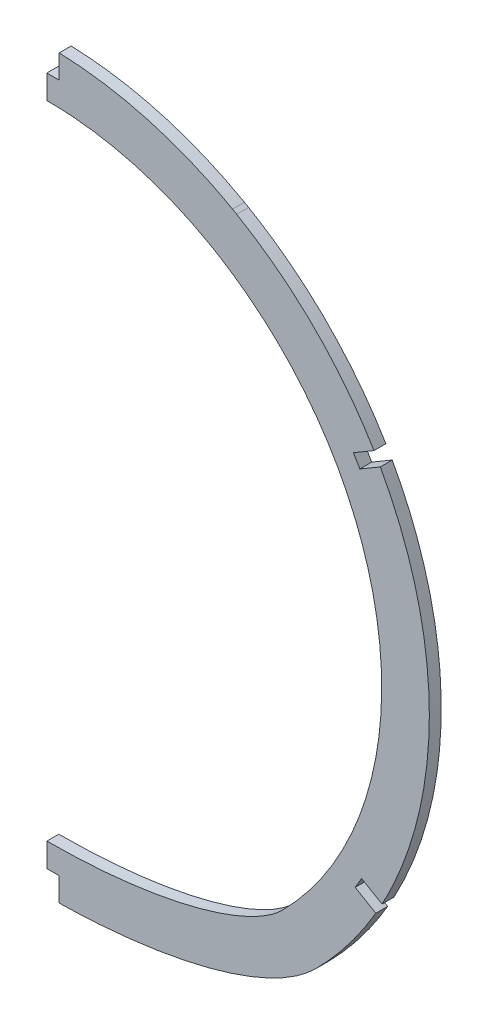
from build123d import *

# Parameters (mm, degrees)
BOSS_EXTRUDE1_DEPTH = 3.175
SKETCH3_W           = 129.389558459
SKETCH3_H           = 294.720660933
CUT_EXTRUDE1_DEPTH  = 146.946732918
SKETCH4_W           = 3.302
SKETCH4_H           = 12.7
CUT_EXTRUDE2_DEPTH  = 146.946411659


with BuildPart() as part:
    # Sketch2 → Boss-Extrude1 (new body)
    with BuildSketch(Plane.XY):
        with BuildLine():
            add(Edge.make_bspline(
                [(-71.677392112, -72.91043434), (-72.109242456, -72.4766599), (-72.972872043, -71.593614958), (-74.469591152, -70.002616718), (-75.837182996, -68.488043391), (-77.186084408, -66.931897067), (-78.515677479, -65.334729876), (-79.824432739, -63.69624614), (-81.54760822, -61.446428575), (-83.64161213, -58.529673548), (-85.629566809, -55.501403393), (-87.162218254, -52.997335562), (-88.285911427, -51.070131488), (-90.114728738, -47.772436811), (-92.549922179, -42.891387424), (-95.3516338, -36.175158441), (-97.806777615, -28.854790192), (-99.416568113, -22.492651102), (-100.484378106, -16.973479224), (-101.217383692, -12.115821661), (-101.805900705, -6.108471449), (-102.055561509, 1.055644647), (-101.63758347, 11.916616183), (-99.581715265, 24.703392789), (-94.947787628, 39.477591596), (-88.656512854, 52.708120751), (-80.043367163, 65.554146484), (-69.871244821, 76.755385293), (-58.636991603, 85.914826096), (-47.202028885, 92.898966836), (-35.790499648, 98.052224226), (-24.000842482, 101.716725174), (-12.029496563, 103.894248368), (-3.656941748, 104.395312689), (0.99110515, 104.372307848), (2.644688984, 104.347784008), (5.295920706, 104.255895368), (8.944129249, 104.002381094), (12.923536456, 103.566176285), (16.897932891, 102.969160213), (20.860675893, 102.210568115), (24.80503533, 101.28991654), (28.724197829, 100.207008268), (32.611281662, 98.961940132), (36.459348765, 97.555109249), (39.942943882, 96.118550993), (42.44327487, 94.981609399), (43.99462248, 94.237634049), (44.922549304, 93.78091779), (45.846607961, 93.314294304), (46.766722746, 92.837849145), (47.682656642, 92.351383169), (48.561810847, 91.873519084), (49.188310006, 91.524412896), (49.500915025, 91.348034768)],
                knots=[0, 0, 0, 0, 0.006795371, 0.013653749, 0.020575359, 0.027560428, 0.034609183, 0.041721853, 0.048898669, 0.063445664, 0.078252032, 0.085753069, 0.093319659, 0.100952039, 0.124124286, 0.148784986, 0.174947707, 0.20262677, 0.215493637, 0.232144402, 0.252599943, 0.276885796, 0.305032091, 0.363115877, 0.408011314, 0.462235121, 0.511576331, 0.564908162, 0.615597651, 0.658548959, 0.700915758, 0.742691235, 0.783870362, 0.824449909, 0.827808956, 0.831171349, 0.841278604, 0.854801757, 0.868378359, 0.882008332, 0.895691582, 0.909427999, 0.923217451, 0.937059793, 0.95095486, 0.964902468, 0.975397534, 0.978902417, 0.982410558, 0.985921952, 0.989436598, 0.99295449, 0.996475625, 1, 1, 1, 1], degree=3))
            add(Edge.make_bspline(
                [(49.500915025, 91.348034768), (49.872005924, 91.138482333), (50.241810712, 90.926750039), (50.610303013, 90.712853821)],
                knots=[0, 0, 0, 0, 1, 1, 1, 1], degree=3))
            add(Edge.make_bspline(
                [(50.610303013, 90.712853821), (51.128442093, 90.411846037), (52.167202685, 89.796039228), (53.932536969, 88.703576387), (55.579762788, 87.638711627), (57.218137155, 86.533145805), (58.847026669, 85.387425363), (60.465187486, 84.201108463), (62.61485058, 82.559008476), (65.268683437, 80.403244909), (68.38020159, 77.661045558), (71.420405526, 74.753669295), (74.379227375, 71.68115848), (77.246352549, 68.444125522), (79.542797672, 65.619898893), (81.324264236, 63.280297585), (82.635173495, 61.479754257), (83.915139631, 59.639466174), (85.682600666, 56.976700672), (87.896856718, 53.369477174), (90.462597049, 48.676901727), (92.889220315, 43.626105667), (95.132677705, 38.215723181), (97.146538959, 32.44823322), (98.88212407, 26.330630408), (100.289240179, 19.875099059), (101.25863273, 13.473856941), (101.817336128, 7.24671143), (102.015185645, 1.305015561), (101.87858065, -4.624237286), (101.39263307, -10.734726225), (100.537146292, -16.867570025), (99.329398352, -22.86381348), (97.893600846, -28.372193875), (96.656960211, -32.269847721), (95.785564151, -34.744415114), (95.0459628, -36.764317914), (93.953188789, -39.535816997), (92.43580554, -43.007047711), (90.821696456, -46.36490671), (89.118620831, -49.608230444), (87.334164726, -52.736260206), (85.475724639, -55.748623833), (83.55049497, -58.64531039), (81.56545684, -61.42664709), (79.307705413, -64.380683017), (77.436977348, -66.647222523), (76.007346494, -68.288860963), (75.29509586, -69.089727056), (74.579038656, -69.87823774), (73.859443089, -70.654502436), (73.136338858, -71.418398838), (72.317504882, -72.264736672), (71.891235125, -72.69667798), (71.678426975, -72.91043429)],
                knots=[0, 0, 0, 0, 0.010157109, 0.020393378, 0.030708694, 0.04110294, 0.051575992, 0.062127721, 0.072757993, 0.094253595, 0.116061609, 0.138180754, 0.160609666, 0.183346893, 0.206390897, 0.218027437, 0.229740057, 0.241528542, 0.253392669, 0.280162256, 0.30828042, 0.337739229, 0.368530108, 0.400643849, 0.434070605, 0.468799897, 0.504820602, 0.536144777, 0.567394405, 0.598569553, 0.629670285, 0.664058743, 0.696204476, 0.726123241, 0.753829745, 0.760691378, 0.767515904, 0.787767528, 0.807687634, 0.827278023, 0.846540474, 0.865476741, 0.88408856, 0.902377642, 0.920345676, 0.937994331, 0.961031903, 0.966703489, 0.972340071, 0.97794171, 0.983508463, 0.989040391, 0.99453755, 1, 1, 1, 1], degree=3))
            add(Edge.make_bspline(
                [(71.678426975, -72.91043429), (46.359928794, -98.341734638), (-46.358893881, -98.341734638), (-71.677392112, -72.91043434)],
                knots=[0, 0, 0, 0, 1, 1, 1, 1], degree=3, weights=[1, 1, 1, 1]))
        make_face()
        with BuildLine():
            add(Edge.make_bspline(
                [(-62.677197057, -63.950161522), (-62.895509204, -63.730876692), (-63.321725733, -63.298342375), (-64.002059554, -62.592101669), (-64.753829554, -61.794622516), (-65.703931611, -60.764569773), (-66.804574903, -59.527416198), (-68.556788175, -57.468052236), (-70.648178443, -54.835505477), (-73.811350461, -50.469012961), (-77.394544541, -44.756057433), (-82.302878117, -35.13540616), (-86.810757895, -22.360038108), (-90.354277409, -0.967371821), (-87.649941962, 26.350088977), (-73.333390238, 55.972118358), (-49.623996274, 78.708841275), (-24.487235723, 89.383519301), (-3.090994932, 92.115890306), (13.038963103, 91.197514401), (26.120286031, 87.996586306), (34.879374941, 84.524845656), (39.102105625, 82.510352052), (41.214271269, 81.410816796), (42.347028641, 80.797644792), (42.959233617, 80.456937494), (43.258169219, 80.288282027)],
                knots=[0, 0, 0, 0, 0.003906217, 0.007812434, 0.01171865, 0.015624867, 0.023437301, 0.031249734, 0.046874602, 0.062499469, 0.093749203, 0.124998938, 0.187498407, 0.249997875, 0.374996813, 0.499995751, 0.624994688, 0.749993626, 0.812493095, 0.874992564, 0.937492033, 0.968741767, 0.984366634, 0.992179068, 0.996085285, 0.999991501, 0.999991501, 0.999991501, 0.999991501], degree=3))
            add(Edge.make_bspline(
                [(43.258169219, 80.288282027), (43.339663738, 80.24226006), (43.502520945, 80.149972739), (43.746371392, 80.01083423), (43.989796594, 79.870982545), (44.151786326, 79.777278604), (44.232713854, 79.73030574)],
                knots=[0.002022438, 0.002022438, 0.002022438, 0.002022438, 0.251013535, 0.500004632, 0.748995729, 0.997986827, 0.997986827, 0.997986827, 0.997986827], degree=3))
            add(Edge.make_bspline(
                [(44.232713854, 79.73030574), (44.58444416, 79.525959484), (45.259622085, 79.127643656), (46.415361761, 78.422292298), (47.573803007, 77.692810893), (49.007921659, 76.758403592), (50.804832808, 75.530634538), (53.607223777, 73.493209173), (57.003409969, 70.790302329), (64.764138566, 63.842060668), (74.853642347, 51.769295456), (84.311822541, 33.000711524), (89.302574517, 12.581832114), (89.594071681, -8.463887057), (85.167338267, -29.022546245), (78.471156755, -43.288686452), (72.737789819, -52.004533398), (70.145497848, -55.492337454), (67.954788222, -58.18874646), (66.537169113, -59.834423786), (65.376799992, -61.124092609), (64.636118066, -61.923784826), (64.04885936, -62.544039678), (63.540759488, -63.072130947), (63.065749199, -63.559376825), (62.8132246, -63.814567336), (62.678231924, -63.950161468)],
                knots=[1.4601e-05, 1.4601e-05, 1.4601e-05, 1.4601e-05, 0.007826987, 0.015639373, 0.023451759, 0.031264145, 0.046888916, 0.062513688, 0.093763232, 0.125012776, 0.250010951, 0.375009125, 0.5000073, 0.625005475, 0.75000365, 0.875001825, 0.906251369, 0.937500913, 0.953125684, 0.968750456, 0.976562842, 0.984375228, 0.988281421, 0.992187614, 0.996093807, 1, 1, 1, 1], degree=3))
            add(Edge.make_bspline(
                [(62.678231924, -63.950161468), (62.442110433, -64.187331736), (61.973465348, -64.632177633), (60.848308103, -65.594894105), (59.178943877, -66.825880953), (56.737455869, -68.325151322), (52.942333804, -70.28884928), (47.260951473, -72.599488515), (39.221466424, -74.977986937), (30.229046438, -76.880115217), (17.304785319, -78.721740765), (0.000517457, -79.658688067), (-17.303750406, -78.721740765), (-30.228011525, -76.880115217), (-39.22043151, -74.977986937), (-47.25991656, -72.599488515), (-52.941298891, -70.28884928), (-56.736420955, -68.325151322), (-59.177908963, -66.825880953), (-60.84727319, -65.594894105), (-61.972430435, -64.632177633), (-62.441075519, -64.187331736), (-62.677197057, -63.950161522)],
                knots=[0, 0, 0, 0, 0.015625, 0.03125, 0.0625, 0.09375, 0.125, 0.1875, 0.25, 0.3125, 0.375, 0.5, 0.625, 0.6875, 0.75, 0.8125, 0.875, 0.90625, 0.9375, 0.96875, 0.984375, 1, 1, 1, 1], degree=3))
        make_face(mode=Mode.SUBTRACT)
    extrude(amount=-BOSS_EXTRUDE1_DEPTH)

    # Sketch3 → Cut-Extrude1 (cut, through all)
    with BuildSketch(Plane(origin=(0, 0, 0), x_dir=(0, 0, -1), z_dir=(1, 0, 0))):
        with Locations((3.684090068, 10.698040846)):
            Rectangle(SKETCH3_W, SKETCH3_H)
    extrude(amount=-CUT_EXTRUDE1_DEPTH, mode=Mode.SUBTRACT)

    # Sketch4 → Cut-Extrude2 (cut, through all)
    with BuildSketch(Plane(origin=(0, 0, -3.175), x_dir=(-1, 0, 0), z_dir=(0, 0, -1))):
        with Locations((-1.651, 104.37520294)):
            Rectangle(SKETCH4_W, SKETCH4_H)
        with Locations((-1.651, -91.983909146)):
            Rectangle(SKETCH4_W, SKETCH4_H)
        Polygon((-94.85658863, -52.383086998), (-93.146727528, -55.296608965), (-82.193637427, -48.868559709), (-83.903498529, -45.955037742), align=None)
        Polygon((-81.722062158, 51.245774998), (-92.675152271, 57.673824233), (-94.385013368, 54.760302263), (-83.431923254, 48.332253027), align=None)
    extrude(amount=-CUT_EXTRUDE2_DEPTH, mode=Mode.SUBTRACT)


solid = part.part
